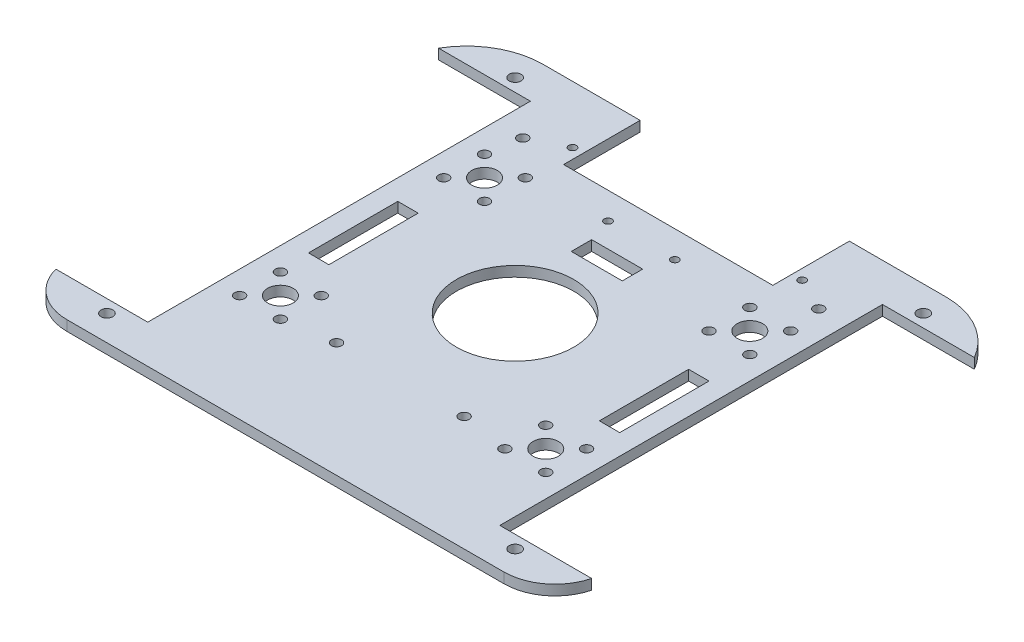
from build123d import *

# Parameters (mm, degrees)
SKETCH1_R           = 2.32
SKETCH1_R_2         = 2
SKETCH1_R_3         = 5
SKETCH1_R_4         = 23
SKETCH1_R_5         = 1.5
SKETCH1_W           = 8
SKETCH1_H           = 35
SKETCH1_W_2         = 20
SKETCH1_H_2         = 8
BOSS_EXTRUDE1_DEPTH = 4
FILLET1_R           = 30
FILLET2_R           = 20


with BuildPart() as part:
    # Sketch1 → Boss-Extrude1 (new body)
    with BuildSketch(Plane(origin=(0, 0, 0), x_dir=(1, 0, 0), z_dir=(0, 1, 0))):
        Polygon((-153.14810061, 75), (-117.14810061, 75), (-117.14810061, -75), (-153.14810061, -75), (-153.14810061, -90), (56.85189939, -90), (56.85189939, -75), (20.85189939, -75), (20.85189939, 75), (56.85189939, 75), (56.85189939, 90), (20.85189939, 90), (-7.14810061, 90), (-7.14810061, 80), (-7.14810061, 60), (-89.14810061, 60), (-89.14810061, 73), (-89.14810061, 90), (-129.14810061, 90), (-153.14810061, 90), align=None)
        with Locations(Location((-128.14810061, -80, 0), (0, 0, 270))):
            Circle(SKETCH1_R, mode=Mode.SUBTRACT)
        with Locations(Location((-128.14810061, 80, 0), (0, 0, 90))):
            Circle(SKETCH1_R, mode=Mode.SUBTRACT)
        with Locations(Location((31.85189939, 80, 0), (0, 0, 270))):
            Circle(SKETCH1_R, mode=Mode.SUBTRACT)
        with Locations(Location((31.85189939, -80, 0), (0, 0, 90))):
            Circle(SKETCH1_R, mode=Mode.SUBTRACT)
        with Locations(Location((-108.14810061, -48, 0), (0, 0, 270))):
            Circle(SKETCH1_R_2, mode=Mode.SUBTRACT)
        with Locations(Location((-92.14810061, -48, 0), (0, 0, 270))):
            Circle(SKETCH1_R_2, mode=Mode.SUBTRACT)
        with Locations(Location((-92.14810061, -32, 0), (0, 0, 90))):
            Circle(SKETCH1_R_2, mode=Mode.SUBTRACT)
        with Locations(Location((-108.14810061, -32, 0), (0, 0, 90))):
            Circle(SKETCH1_R_2, mode=Mode.SUBTRACT)
        with Locations(Location((-100.14810061, -40, 0), (0, 0, 270))):
            Circle(SKETCH1_R_3, mode=Mode.SUBTRACT)
        with Locations(Location((-92.14810061, 48, 0), (0, 0, 90))):
            Circle(SKETCH1_R_2, mode=Mode.SUBTRACT)
        with Locations(Location((-108.14810061, 48, 0), (0, 0, 90))):
            Circle(SKETCH1_R_2, mode=Mode.SUBTRACT)
        with Locations(Location((-92.14810061, 32, 0), (0, 0, 270))):
            Circle(SKETCH1_R_2, mode=Mode.SUBTRACT)
        with Locations(Location((-100.14810061, 40, 0), (0, 0, 90))):
            Circle(SKETCH1_R_3, mode=Mode.SUBTRACT)
        with Locations(Location((-108.14810061, 32, 0), (0, 0, 270))):
            Circle(SKETCH1_R_2, mode=Mode.SUBTRACT)
        with Locations(Location((-4.14810061, -32, 0), (0, 0, 270))):
            Circle(SKETCH1_R_2, mode=Mode.SUBTRACT)
        with Locations(Location((-4.14810061, -48, 0), (0, 0, 90))):
            Circle(SKETCH1_R_2, mode=Mode.SUBTRACT)
        with Locations(Location((3.85189939, -40, 0), (0, 0, 90))):
            Circle(SKETCH1_R_3, mode=Mode.SUBTRACT)
        with Locations(Location((11.85189939, -48, 0), (0, 0, 90))):
            Circle(SKETCH1_R_2, mode=Mode.SUBTRACT)
        with Locations(Location((11.85189939, -32, 0), (0, 0, 270))):
            Circle(SKETCH1_R_2, mode=Mode.SUBTRACT)
        with Locations(Location((-4.14810061, 32, 0), (0, 0, 90))):
            Circle(SKETCH1_R_2, mode=Mode.SUBTRACT)
        with Locations(Location((-4.14810061, 48, 0), (0, 0, 270))):
            Circle(SKETCH1_R_2, mode=Mode.SUBTRACT)
        with Locations(Location((11.85189939, 32, 0), (0, 0, 90))):
            Circle(SKETCH1_R_2, mode=Mode.SUBTRACT)
        with Locations(Location((11.85189939, 48, 0), (0, 0, 270))):
            Circle(SKETCH1_R_2, mode=Mode.SUBTRACT)
        with Locations(Location((3.85189939, 40, 0), (0, 0, 270))):
            Circle(SKETCH1_R_3, mode=Mode.SUBTRACT)
        with Locations(Location((-48.14810061, 0, 0), (0, 0, 270))):
            Circle(SKETCH1_R_4, mode=Mode.SUBTRACT)
        with Locations(Location((-93.14810061, 67.5, 0), (0, 0, 270))):
            Circle(SKETCH1_R_5, mode=Mode.SUBTRACT)
        with Locations(Location((-3.14810061, 67.5, 0), (0, 0, 90))):
            Circle(SKETCH1_R_5, mode=Mode.SUBTRACT)
        with Locations(Location((-61.24810061, 49.5, 0), (0, 0, 270))):
            Circle(SKETCH1_R_5, mode=Mode.SUBTRACT)
        with Locations(Location((-35.04810061, 49.5, 0), (0, 0, 90))):
            Circle(SKETCH1_R_5, mode=Mode.SUBTRACT)
        with Locations(Location((-73.14810061, -45, 0), (0, 0, 270))):
            Circle(SKETCH1_R_2, mode=Mode.SUBTRACT)
        with Locations(Location((-23.14810061, -45, 0), (0, 0, 90))):
            Circle(SKETCH1_R_2, mode=Mode.SUBTRACT)
        with Locations(Location((9.85189939, 61, 0), (0, 0, 270))):
            Circle(SKETCH1_R_2, mode=Mode.SUBTRACT)
        with Locations(Location((-106.14810061, 61, 0), (0, 0, 90))):
            Circle(SKETCH1_R_2, mode=Mode.SUBTRACT)
        with Locations((-105.14810061, -2.5)):
            Rectangle(SKETCH1_W, SKETCH1_H, mode=Mode.SUBTRACT)
        with Locations((8.85189939, -2.5)):
            Rectangle(SKETCH1_W, SKETCH1_H, mode=Mode.SUBTRACT)
        with Locations((-48.14810061, 36)):
            Rectangle(SKETCH1_W_2, SKETCH1_H_2, mode=Mode.SUBTRACT)
    extrude(amount=BOSS_EXTRUDE1_DEPTH)

    # Fillet1
    # the kernel refuses this fillet: 30 mm, written as the material it takes off along each edge
    with BuildSketch(Plane(origin=(-153.14810061, -64.951905284, -90), x_dir=(1, 0, 0), z_dir=(0, 1, 0))) as fillet1_piece_1:
        with BuildLine():
            CenterArc((25.980762114, -30), FILLET1_R, 90, 60)
            Line((0, -15), (-0.519615242, -14.7))
            ThreePointArc((-0.519615242, -14.7), (-0.6, -7.5), (-0.6, 0))
            Line((-0.6, 0), (0, 0.6))
            Line((0, 0.6), (25.980762114, 0.6))
            Line((25.980762114, 0.6), (25.980762114, 0))
        make_face()
    extrude(amount=133.903810568, mode=Mode.SUBTRACT)
    with BuildSketch(Plane(origin=(56.85189939, -64.951905284, -90), x_dir=(-1, 0, 0), z_dir=(0, 1, 0))) as fillet1_piece_2:
        with BuildLine():
            CenterArc((25.980762114, 30), FILLET1_R, 210, 60)
            Line((0, 15), (-0.519615242, 14.7))
            ThreePointArc((-0.519615242, 14.7), (-0.6, 7.5), (-0.6, 0))
            Line((-0.6, 0), (0, -0.6))
            Line((0, -0.6), (25.980762114, -0.6))
            Line((25.980762114, -0.6), (25.980762114, 0))
        make_face()
    extrude(amount=133.903810568, mode=Mode.SUBTRACT)

    # Fillet2
    # the kernel refuses this fillet: 20 mm, written as the material it takes off along each edge
    with BuildSketch(Plane(origin=(56.85189939, -48.412291828, 90), x_dir=(0, 0, -1), z_dir=(0, 1, 0))) as fillet2_piece_1:
        with BuildLine():
            CenterArc((20, 19.364916731), FILLET2_R, 180, 75.522487814)
            Line((0, 19.364916731), (-0.4, 19.364916731))
            Line((-0.4, 19.364916731), (-0.4, 0))
            Line((-0.4, 0), (0, -0.4))
            ThreePointArc((0, -0.4), (7.5, -0.4), (14.9, -0.387298335))
            Line((14.9, -0.387298335), (15, 0))
        make_face()
    extrude(amount=100.824583655, mode=Mode.SUBTRACT)
    with BuildSketch(Plane(origin=(-153.14810061, -48.412291828, 90), x_dir=(1, 0, 0), z_dir=(0, 1, 0))) as fillet2_piece_2:
        with BuildLine():
            CenterArc((19.364916731, 20), FILLET2_R, 194.477512186, 75.522487814)
            Line((0, 15), (-0.387298335, 14.9))
            ThreePointArc((-0.387298335, 14.9), (-0.4, 7.5), (-0.4, 0))
            Line((-0.4, 0), (0, -0.4))
            Line((0, -0.4), (19.364916731, -0.4))
            Line((19.364916731, -0.4), (19.364916731, 0))
        make_face()
    extrude(amount=100.824583655, mode=Mode.SUBTRACT)


solid = part.part
